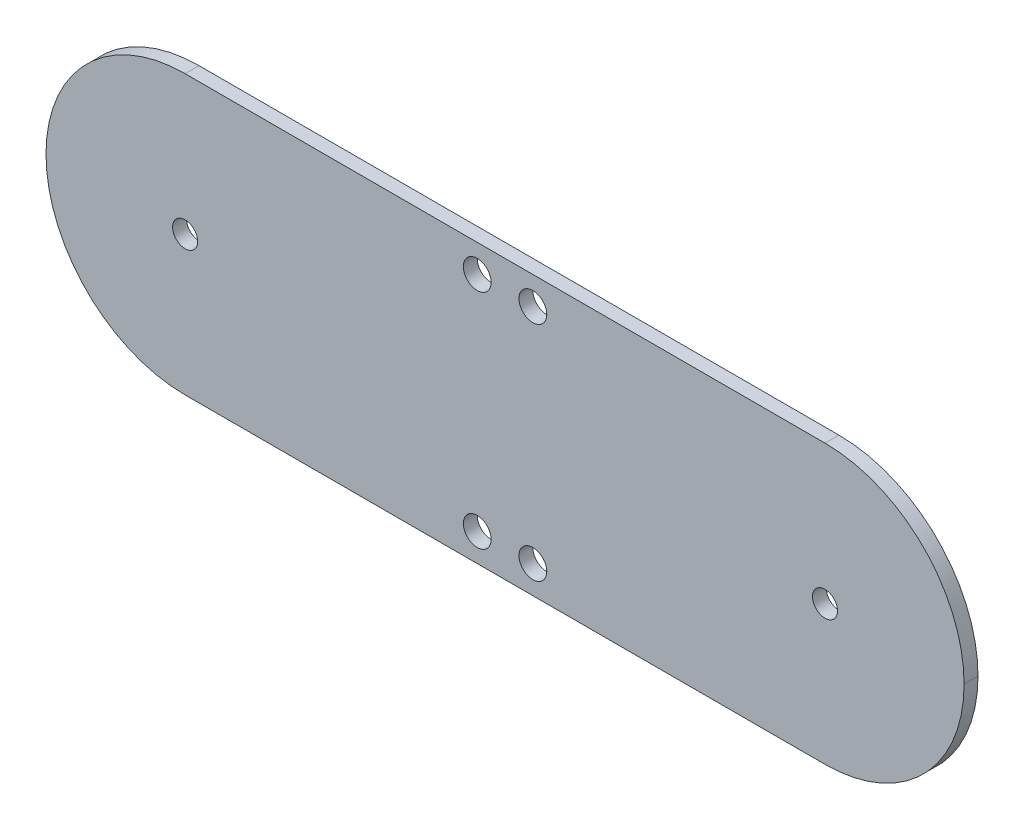
from build123d import *

# Parameters (mm, degrees)
SKETCH1_W           = 165
SKETCH1_H           = 50
BOSS_EXTRUDE1_DEPTH = 2.5
FILLET1_R           = 25
SKETCH2_R           = 2.5
CUT_EXTRUDE1_DEPTH  = 2.5
SKETCH4_R           = 2.25
CUT_EXTRUDE2_DEPTH  = 10


with BuildPart() as part:
    # Sketch1 → Boss-Extrude1 (new body)
    with BuildSketch(Plane.XY):
        Rectangle(SKETCH1_W, SKETCH1_H)
    extrude(amount=BOSS_EXTRUDE1_DEPTH)

    # Fillet1
    fillet1_edges = [part.edges().sort_by_distance(p)[0] for p in [
        (-82.5, -25, 1.25),
        (-82.5, 25, 1.25),
        (82.5, -25, 1.25),
        (82.5, 25, 1.25),
    ]]
    fillet(fillet1_edges, radius=FILLET1_R - 0.0001)  # a hair under: the kernel refuses the full size

    # Sketch2 → Cut-Extrude1 (cut)
    with BuildSketch(Plane.XY.offset(2.5)):
        with Locations((-5, 20)):
            Circle(SKETCH2_R)
        with Locations((5, 20)):
            Circle(SKETCH2_R)
    cut_extrude1 = extrude(amount=-CUT_EXTRUDE1_DEPTH, mode=Mode.SUBTRACT)

    # Mirror1: Cut-Extrude1 across plane
    add(cut_extrude1.mirror(Plane.ZX), mode=Mode.SUBTRACT)

    # Sketch4 → Cut-Extrude2 (cut)
    with BuildSketch(Plane.XY.offset(2.5)):
        with Locations((-57.5, 0)):
            Circle(SKETCH4_R)
    cut_extrude2 = extrude(amount=-CUT_EXTRUDE2_DEPTH, mode=Mode.SUBTRACT)

    # Mirror2: Cut-Extrude2 across plane
    add(cut_extrude2.mirror(Plane(origin=(0, 0, 0), x_dir=(0, 0, 1), z_dir=(1, 0, 0))), mode=Mode.SUBTRACT)


solid = part.part
